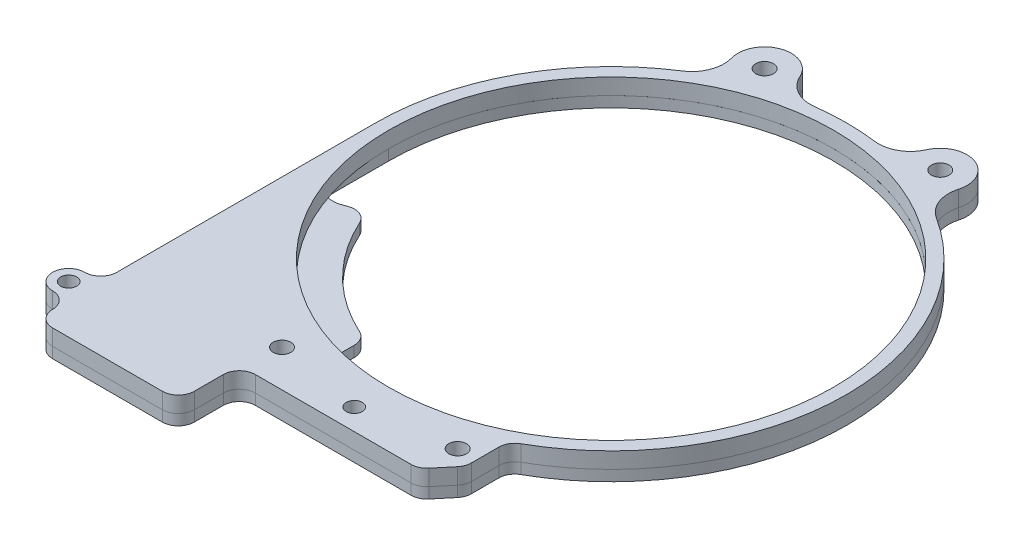
from build123d import *

# Parameters (mm, degrees)
EXTRUDE_1_OUTLINE_R   = 1.65
EXTRUDE_1_OUTLINE_R_2 = 1.5
EXTRUDE_1_DEPTH       = 2
FILLET_1_R            = 3
CUT_EXTRUDE_START     = -10
CUT_EXTRUDE_1_DEPTH   = 10
SKETCH_5_W            = 26.5
SKETCH_5_H            = 11.4
EXTRUDE_2_DEPTH       = 2
SKETCH_6_W            = 6
SKETCH_6_H            = 6
SKETCH_6_R            = 1.5
EXTRUDE_3_DEPTH       = 2
FILLET_2_R            = 3
SKETCH_7_R            = 41.6
SKETCH_7_R_2          = 1.65
SKETCH_7_R_3          = 1.5
EXTRUDE_4_DEPTH       = 3


# Read off the part's stored shape, not the designer's step: 凸台-拉伸1
with BuildPart() as part:
    # 凸台-拉伸1 outline → 凸台-拉伸1 (new body)
    with BuildSketch(Plane(origin=(0, 0, 0), x_dir=(1, 0, 0), z_dir=(0, 1, 0))):
        with BuildLine():
            ThreePointArc((-11.851824833, 47.144725656), (-18.127067596, 49.803708902), (-21.22502096, 43.733161266))
            ThreePointArc((-21.22502096, 43.733161266), (-21.381953702, 39.965990651), (-23.755323553, 37.036260649))
            ThreePointArc((-23.755323553, 37.036260649), (-38.608510955, 21.104096328), (-44, 0))
            Line((-44, 0), (-44, -52))
            Line((-44, -52), (16, -52))
            ThreePointArc((16, -52), (36.555057081, -29.52964612), (44, 0))
            ThreePointArc((44, 0), (38.608510955, 21.104096328), (23.755323553, 37.036260649))
            ThreePointArc((23.755323553, 37.036260649), (21.381953702, 39.965990651), (21.22502096, 43.733161266))
            ThreePointArc((21.22502096, 43.733161266), (18.127067596, 49.803708902), (11.851824833, 47.144725656))
            ThreePointArc((11.851824833, 47.144725656), (9.310116783, 44.359779962), (5.608815852, 43.641049308))
            ThreePointArc((5.608815852, 43.641049308), (0, 44), (-5.608815852, 43.641049308))
            ThreePointArc((-5.608815852, 43.641049308), (-9.310116783, 44.359779962), (-11.851824833, 47.144725656))
        make_face()
        with Locations((-16.41696688, -45.105245798)):
            Circle(EXTRUDE_1_OUTLINE_R, mode=Mode.SUBTRACT)
        with Locations((0, -48)):
            Circle(EXTRUDE_1_OUTLINE_R_2, mode=Mode.SUBTRACT)
        with Locations((16.41696688, -45.105245798)):
            Circle(EXTRUDE_1_OUTLINE_R, mode=Mode.SUBTRACT)
        with Locations((-16.41696688, 45.105245798)):
            Circle(EXTRUDE_1_OUTLINE_R, mode=Mode.SUBTRACT)
        with BuildLine():
            Line((-13, -39.516578799), (-13, -33.034073318))
            ThreePointArc((-13, -33.034073318), (-25.424671464, -24.775715549), (-33.359088038, -12.141715088))
            Line((-33.359088038, -12.141715088), (-37.587704831, -13.680805733))
            Line((-37.587704831, -13.680805733), (-41.6, -13.680805733))
            Line((-41.6, -13.680805733), (-41.6, 0))
            ThreePointArc((-41.6, 0), (33.699851632, 24.390161951), (-13, -39.516578799))
        make_face(mode=Mode.SUBTRACT)
        with Locations((16.41696688, 45.105245798)):
            Circle(EXTRUDE_1_OUTLINE_R, mode=Mode.SUBTRACT)
    extrude(amount=EXTRUDE_1_DEPTH)

    # 圆角1
    fillet_1_edges = [part.edges().sort_by_distance(p)[0] for p in [
        (-13, 1, 33.034073318),
        (-13, 1, 39.516578799),
        (-41.6, 1, 13.680805733),
        (-37.587704831, 1, 13.680805733),
        (-33.359088038, 1, 12.141715088),
    ]]
    fillet(fillet_1_edges, radius=FILLET_1_R)

    # 草图3 → 切除-拉伸1 (cut)
    with BuildSketch(Plane(origin=(0, 2, 0), x_dir=(1, 0, 0), z_dir=(0, 1, 0)).offset(CUT_EXTRUDE_START)):
        with BuildLine():
            Line((20, -47.191835885), (16, -52))
            ThreePointArc((16, -52), (36.555057081, -29.52964612), (44, 0))
            ThreePointArc((44, 0), (37.523326079, -22.978250586), (20, -39.191835885))
            Line((20, -39.191835885), (20, -47.191835885))
        make_face()
    extrude(amount=CUT_EXTRUDE_1_DEPTH, mode=Mode.SUBTRACT)

    # 草图5 → 凸台-拉伸2 (add)
    with BuildSketch(Plane(origin=(0, 2, 0), x_dir=(1, 0, 0), z_dir=(0, 1, 0))):
        with Locations((-30.75, -57.7)):
            Rectangle(SKETCH_5_W, SKETCH_5_H)
    extrude(amount=-EXTRUDE_2_DEPTH)

    # 草图6 → 凸台-拉伸3 (add)
    with BuildSketch(Plane(origin=(0, 2, 0), x_dir=(1, 0, 0), z_dir=(0, 1, 0))):
        with Locations((-47, -54.4)):
            Rectangle(SKETCH_6_W, SKETCH_6_H)
        with Locations(Location((-47, -54.4, 0), (0, 0, 270))):
            Circle(SKETCH_6_R, mode=Mode.SUBTRACT)
    extrude(amount=-EXTRUDE_3_DEPTH)

    # 圆角2
    fillet_2_edges = [part.edges().sort_by_distance(p)[0] for p in [
        (20, 1, 39.191835885),
        (20, 1, 47.191835885),
        (-17.5, 1, 52),
        (-17.5, 1, 63.4),
        (-44, 1, 63.4),
        (-44, 1, 51.4),
        (16, 1, 52),
        (-44, 1, 57.4),
        (-50, 1, 57.4),
        (-50, 1, 51.4),
    ]]
    fillet(fillet_2_edges, radius=FILLET_2_R - 0.0001)  # a hair under: the kernel refuses the full size


with BuildPart() as body_2:
    # 草图7 → 凸台-拉伸4 (new body)
    with BuildSketch(Plane(origin=(0, 2, 0), x_dir=(1, 0, 0), z_dir=(0, 1, 0))):
        with BuildLine():
            Line((-41, -63.4), (-20.5, -63.4))
            ThreePointArc((-20.5, -63.4), (-18.378679656, -62.521320344), (-17.5, -60.4))
            Line((-17.5, -60.4), (-17.5, -55))
            ThreePointArc((-17.5, -55), (-16.621320344, -52.878679656), (-14.5, -52))
            Line((-14.5, -52), (14.59334641, -52))
            ThreePointArc((14.59334641, -52), (15.866947619, -51.716236359), (16.899614351, -50.91862664))
            Line((16.899614351, -50.91862664), (19.306267941, -48.025730283))
            ThreePointArc((19.306267941, -48.025730283), (19.8212412, -47.12720074), (20, -46.107103642))
            Line((20, -46.107103642), (20, -40.987803064))
            ThreePointArc((20, -40.987803064), (20.411153218, -39.471929606), (21.531914894, -38.371560315))
            ThreePointArc((21.531914894, -38.371560315), (43.980886271, -1.296781715), (23.755323553, 37.036260649))
            ThreePointArc((23.755323553, 37.036260649), (21.381953702, 39.965990651), (21.22502096, 43.733161266))
            ThreePointArc((21.22502096, 43.733161266), (18.127067596, 49.803708902), (11.851824833, 47.144725656))
            ThreePointArc((11.851824833, 47.144725656), (9.310116783, 44.359779962), (5.608815852, 43.641049308))
            ThreePointArc((5.608815852, 43.641049308), (0, 44), (-5.608815852, 43.641049308))
            ThreePointArc((-5.608815852, 43.641049308), (-9.310116783, 44.359779962), (-11.851824833, 47.144725656))
            ThreePointArc((-11.851824833, 47.144725656), (-18.127067596, 49.803708902), (-21.22502096, 43.733161266))
            ThreePointArc((-21.22502096, 43.733161266), (-21.381953702, 39.965990651), (-23.755323553, 37.036260649))
            ThreePointArc((-23.755323553, 37.036260649), (-38.608510955, 21.104096328), (-44, 0))
            Line((-44, 0), (-44, -48.4))
            ThreePointArc((-44, -48.4), (-44.878679656, -50.521320344), (-47, -51.4))
            ThreePointArc((-47, -51.4), (-49.121320344, -52.278679656), (-50, -54.4))
            ThreePointArc((-50, -54.4), (-49.121320344, -56.521320344), (-47, -57.4))
            ThreePointArc((-47, -57.4), (-44.878679656, -58.278679656), (-44, -60.4))
            ThreePointArc((-44, -60.4), (-43.121320344, -62.521320344), (-41, -63.4))
        make_face()
        with Locations(Location((0, 0, 0), (0, 0, 270))):
            Circle(SKETCH_7_R, mode=Mode.SUBTRACT)
        with Locations(Location((16.41696688, -45.105245798, 0), (0, 0, 270))):
            Circle(SKETCH_7_R_2, mode=Mode.SUBTRACT)
        with Locations(Location((0, -48, 0), (0, 0, 270))):
            Circle(SKETCH_7_R_3, mode=Mode.SUBTRACT)
        with Locations(Location((-16.41696688, -45.105245798, 0), (0, 0, 270))):
            Circle(SKETCH_7_R_2, mode=Mode.SUBTRACT)
        with Locations(Location((16.41696688, 45.105245798, 0), (0, 0, 270))):
            Circle(SKETCH_7_R_2, mode=Mode.SUBTRACT)
        with Locations(Location((-16.41696688, 45.105245798, 0), (0, 0, 270))):
            Circle(SKETCH_7_R_2, mode=Mode.SUBTRACT)
        with Locations(Location((-47, -54.4, 0), (0, 0, 270))):
            Circle(SKETCH_7_R_3, mode=Mode.SUBTRACT)
    extrude(amount=EXTRUDE_4_DEPTH)


solid = Compound([part.part, body_2.part])
